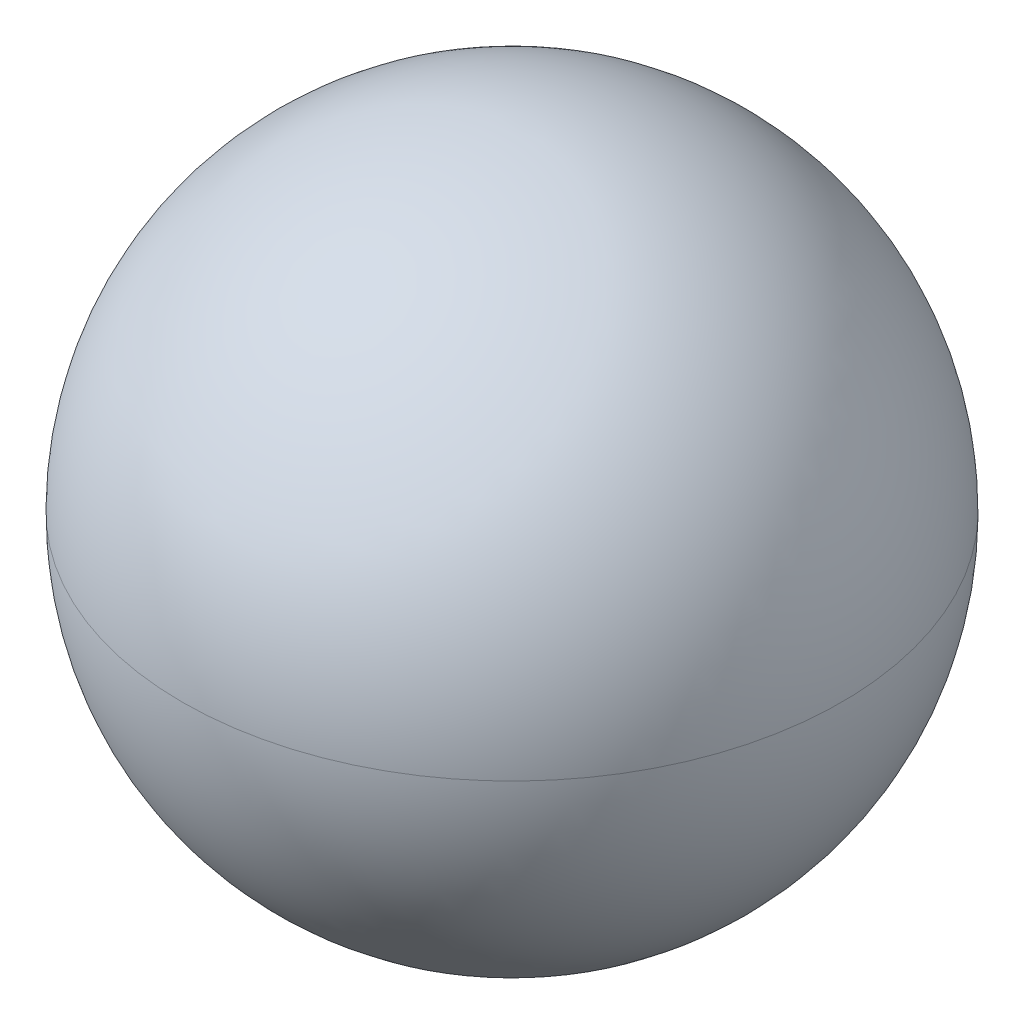
from build123d import *

# Parameters (mm, degrees)
SKETCH1_R           = 304.8
BOSS_EXTRUDE1_DEPTH = 609.6
FILLET1_R           = 304.8
SHELL2_T            = 3.175


with BuildPart() as part:
    # Sketch1 → Boss-Extrude1 (new body)
    with BuildSketch(Plane(origin=(0, 0, 0), x_dir=(1, 0, 0), z_dir=(0, 1, 0))):
        with Locations(Location((0, 0, 0), (0, 0, 90))):
            Circle(SKETCH1_R)
    extrude(amount=BOSS_EXTRUDE1_DEPTH)

    # Fillet1
    fillet1_edges = [part.edges().sort_by_distance(p)[0] for p in [
        (0, 0, 304.8),
        (0, 609.6, 304.8),
    ]]
    fillet(fillet1_edges, radius=FILLET1_R - 0.0001)  # a hair under: the kernel refuses the full size

    # Shell2 (no face opened: a closed hollow body)
    add(offset(amount=-SHELL2_T, mode=Mode.PRIVATE), mode=Mode.SUBTRACT)


solid = part.part
